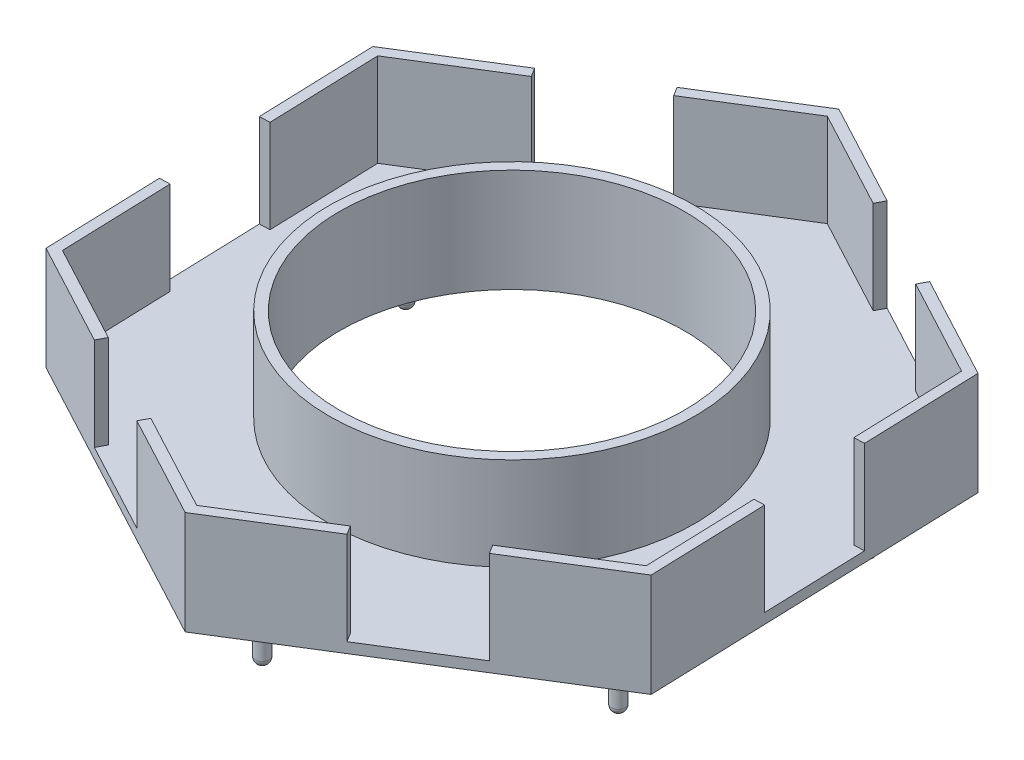
from build123d import *

# Parameters (mm, degrees)
SKETCH2_R           = 50
BOSS_EXTRUDE1_DEPTH = 30
SKETCH4_R           = 2
BOSS_EXTRUDE2_DEPTH = 20
FILLET1_R           = 2
SHELL1_START        = 3
SHELL1_OUTLINE_R    = 53
SHELL1_DEPTH        = 27
CUT_EXTRUDE1_DEPTH  = 27


# Read off the part's stored shape, not the designer's step: Shell1
with BuildPart() as part:
    # Sketch2 → Boss-Extrude1 (new body)
    with BuildSketch(Plane(origin=(0, 0, 0), x_dir=(1, 0, 0), z_dir=(0, 1, 0))):
        Polygon((-83.314894361, -51.8841181), (3.275517147, -98.09487408), (86.590411508, -46.21075598), (83.314894361, 51.8841181), (-3.275517147, 98.09487408), (-86.590411508, 46.21075598), align=None)
        with Locations(Location((0, 0, 0), (0, 0, 270))):
            Circle(SKETCH2_R, mode=Mode.SUBTRACT)
    extrude(amount=BOSS_EXTRUDE1_DEPTH)

    # Sketch4 → Boss-Extrude2 (add)
    with BuildSketch(Plane.XZ):
        with Locations(Location((-66.167202432, -35.311489947, 0), (0, 0, 90))):
            Circle(SKETCH4_R)
        with Locations(Location((-63.664248556, 39.64673323, 0), (0, 0, 90))):
            Circle(SKETCH4_R)
        with Locations(Location((2.502953876, 74.958223177, 0), (0, 0, 90))):
            Circle(SKETCH4_R)
        with Locations(Location((66.167202432, 35.311489947, 0), (0, 0, 90))):
            Circle(SKETCH4_R)
        with Locations(Location((63.664248556, -39.64673323, 0), (0, 0, 90))):
            Circle(SKETCH4_R)
        with Locations(Location((-2.502953876, -74.958223177, 0), (0, 0, 90))):
            Circle(SKETCH4_R)
    extrude(amount=BOSS_EXTRUDE2_DEPTH)

    # Fillet1
    fillet1_edges = [part.edges().sort_by_distance(p)[0] for p in [
        (-63.664248556, 0, 37.64673323),
        (-63.664248556, -20, 37.64673323),
        (-66.167202432, 0, -37.311489947),
        (-66.167202432, -20, -37.311489947),
        (66.167202432, 0, 33.311489947),
        (66.167202432, -20, 33.311489947),
        (2.502953876, 0, 72.958223177),
        (2.502953876, -20, 72.958223177),
        (-2.502953876, 0, -76.958223177),
        (-2.502953876, -20, -76.958223177),
        (63.664248556, 0, -41.64673323),
        (63.664248556, -20, -41.64673323),
    ]]
    fillet(fillet1_edges, radius=FILLET1_R)

    # Shell1 outline → Shell1 (cut)
    with BuildSketch(Plane(origin=(0, 0, 0), x_dir=(1, 0, 0), z_dir=(0, 1, 0)).offset(SHELL1_START)):
        Polygon((-83.534279337, 44.579788122), (-80.374368678, -50.052913931), (3.159910659, -94.632702054), (83.534279337, -44.579788122), (80.374368678, 50.052913931), (-3.159910659, 94.632702054), align=None)
        Circle(SHELL1_OUTLINE_R, mode=Mode.SUBTRACT)
    extrude(amount=SHELL1_DEPTH, mode=Mode.SUBTRACT)

    # Sketch8 → Cut-Extrude1 (cut)
    with BuildSketch(Plane(origin=(0, 30, 0), x_dir=(1, 0, 0), z_dir=(0, 1, 0))):
        Polygon((53.253129093, 67.9271981), (51.840669496, 65.280510003), (25.373788523, 79.405105982), (26.786248121, 82.051794079), align=None)
        Polygon((84.452062159, 17.828325695), (85.453243709, -12.154963576), (82.454914782, -12.255081731), (81.453733232, 17.72820754), align=None)
        Polygon((57.665814038, -64.223468384), (32.200114616, -80.082161676), (30.614245287, -77.535591734), (56.079944709, -61.676898442), align=None)
        Polygon((-26.786248121, -82.051794079), (-53.253129093, -67.9271981), (-51.840669496, -65.280510003), (-25.373788523, -79.405105982), align=None)
        Polygon((-84.452062159, -17.828325695), (-85.453243709, 12.154963576), (-82.454914782, 12.255081731), (-81.453733232, -17.72820754), align=None)
        Polygon((-57.665814038, 64.223468384), (-32.200114616, 80.082161676), (-30.614245287, 77.535591734), (-56.079944709, 61.676898442), align=None)
    extrude(amount=-CUT_EXTRUDE1_DEPTH, mode=Mode.SUBTRACT)


solid = part.part
